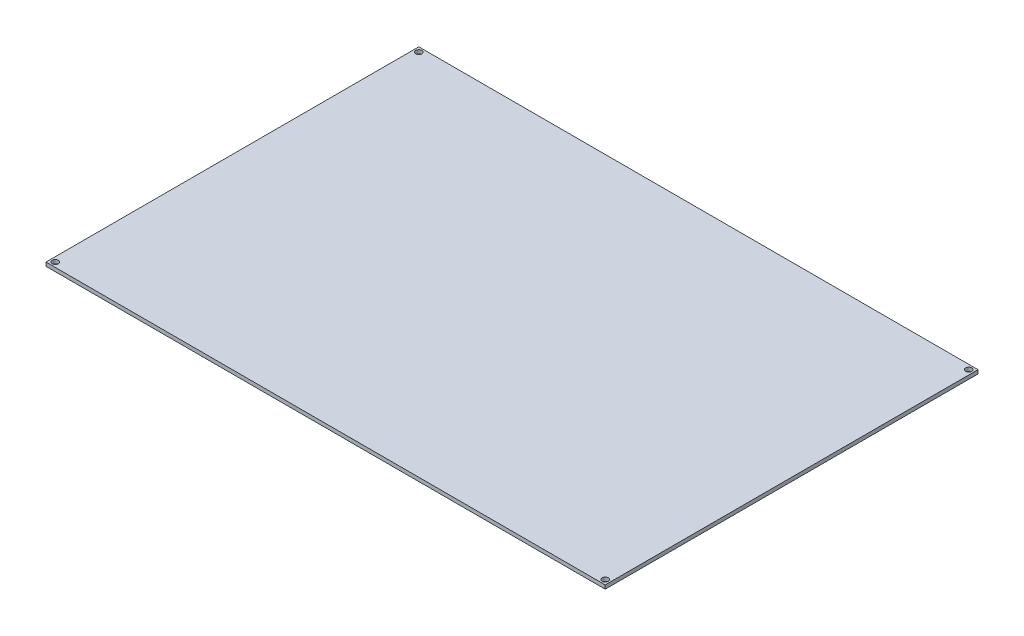
from build123d import *

# Parameters (mm, degrees)
SKETCH1_W           = 300
SKETCH1_H           = 200
SKETCH1_R           = 1.65
BOSS_EXTRUDE1_DEPTH = 2


with BuildPart() as part:
    # Sketch1 → Boss-Extrude1 (new body)
    with BuildSketch(Plane(origin=(0, 0, 0), x_dir=(1, 0, 0), z_dir=(0, 1, 0))):
        with Locations((150, 100)):
            Rectangle(SKETCH1_W, SKETCH1_H)
        with Locations((2.5, 2.5)):
            Circle(SKETCH1_R, mode=Mode.SUBTRACT)
        with Locations((297.5, 2.5)):
            Circle(SKETCH1_R, mode=Mode.SUBTRACT)
        with Locations((297.5, 197.5)):
            Circle(SKETCH1_R, mode=Mode.SUBTRACT)
        with Locations((2.5, 197.5)):
            Circle(SKETCH1_R, mode=Mode.SUBTRACT)
    extrude(amount=BOSS_EXTRUDE1_DEPTH)


solid = part.part
